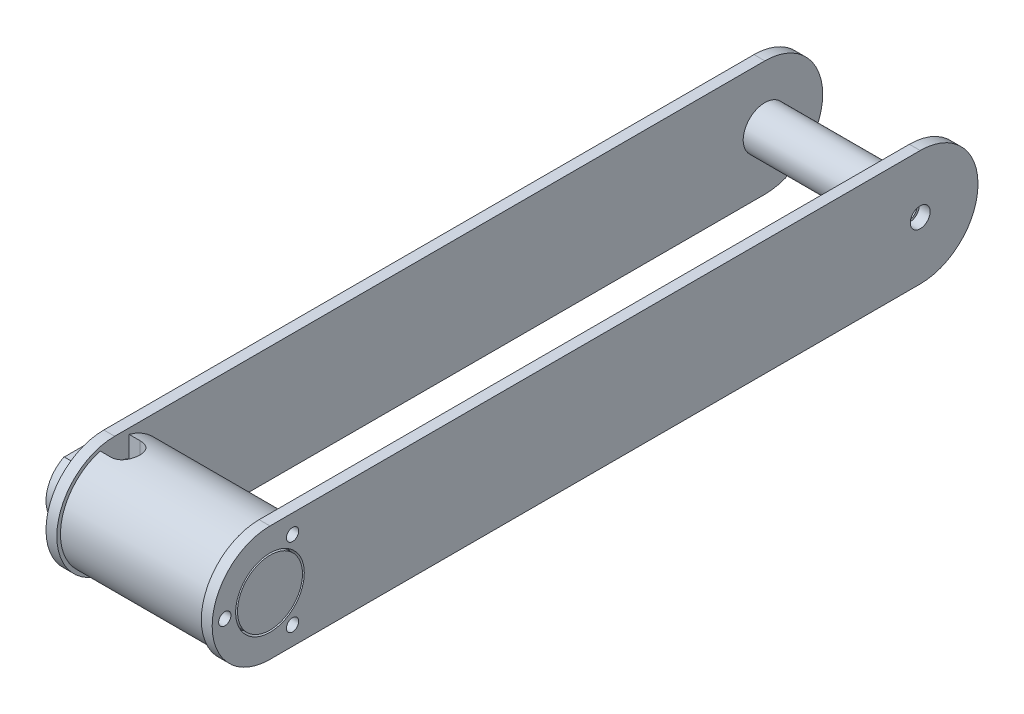
from build123d import *

# Parameters (mm, degrees)
SKETCH1_R                    = 15
BOSS_EXTRUDE1_DEPTH          = 20
SKETCH11_R                   = 9
BOSS_EXTRUDE4_DEPTH          = 10
BOSS_EXTRUDE5_START          = 3
SKETCH12_R                   = 9
BOSS_EXTRUDE5_DEPTH          = 3
SKETCH2_R                    = 2.75
SKETCH2_R_2                  = 9.5
BOSS_EXTRUDE2_DEPTH          = 3
SKETCH13_R                   = 6
BOSS_EXTRUDE6_DEPTH          = 40
M3_START                     = 20
M3_CLEARANCE_HOLE1_OUTLINE_R = 1.7
M3_CLEARANCE_HOLE1_DEPTH     = 3
CUT_EXTRUDE1_DEPTH           = 8
CUT_EXTRUDE3_DEPTH           = 202.298286133
SKETCH16_R                   = 2
CUT_EXTRUDE2_DEPTH           = 30
SKETCH18_W                   = 1.25
SKETCH18_H                   = 8
M3_TAPPED_HOLE2_AT_2_COUNT   = 2
M3_TAPPED_HOLE2_AT_2_PITCH   = 9
M3_TAPPED_HOLE1_AT_2_COUNT   = 2
M3_TAPPED_HOLE1_AT_2_PITCH   = 21.650635095
M3_TAPPED_HOLE1_AT_3_COUNT   = 2
M3_TAPPED_HOLE1_AT_3_PITCH   = 21.650635095


# Read off the part's stored shape, not the designer's step: M3 Clearance Hole1
with BuildPart() as part:
    # Sketch1 → Boss-Extrude1 (new, symmetric)
    with BuildSketch(Plane(origin=(0, 0, 0), x_dir=(0, 0, -1), z_dir=(1, 0, 0))):
        Circle(SKETCH1_R)
    extrude(amount=BOSS_EXTRUDE1_DEPTH, both=True)

    # Sketch11 → Boss-Extrude4 (add)
    with BuildSketch(Plane.ZY.offset(20)):
        Circle(SKETCH11_R)
    extrude(amount=BOSS_EXTRUDE4_DEPTH)

    # Sketch12 → Boss-Extrude5 (add)
    with BuildSketch(Plane(origin=(20, 0, 0), x_dir=(0, 0, -1), z_dir=(1, 0, 0)).offset(BOSS_EXTRUDE5_START)):
        with Locations(Location((0, 0, 0), (0, 0, 180))):
            Circle(SKETCH12_R)
    extrude(amount=-BOSS_EXTRUDE5_DEPTH)

    # Sketch15 → Cut-Extrude1 (cut)
    with BuildSketch(Plane(origin=(0, 16, 0), x_dir=(1, 0, 0), z_dir=(0, 1, 0))):
        with BuildLine():
            Line((-17, -4), (-20, -4))
            Line((-20, -4), (-20, 4))
            Line((-20, 4), (-17, 4))
            ThreePointArc((-17, 4), (-13, 0), (-17, -4))
        make_face()
    extrude(amount=-CUT_EXTRUDE1_DEPTH, mode=Mode.SUBTRACT)

    # Sketch23 → Cut-Extrude3 (cut, through all)
    with BuildSketch(Plane(origin=(-20, 0, 0), x_dir=(0, 0, -1), z_dir=(1, 0, 0))):
        with BuildLine():
            Line((-4, 8), (4, 8))
            Line((4, 8), (4, 8.062257748))
            ThreePointArc((4, 8.062257748), (0, 9), (-4, 8.062257748))
            Line((-4, 8.062257748), (-4, 8))
        make_face()
    extrude(amount=-CUT_EXTRUDE3_DEPTH, mode=Mode.SUBTRACT)

    # Sketch16 → Cut-Extrude2 (cut)
    with BuildSketch(Plane.ZY.offset(30)):
        Circle(SKETCH16_R)
    extrude(amount=-CUT_EXTRUDE2_DEPTH, mode=Mode.SUBTRACT)

    # Sketch18 → M3 Tapped Hole2 (revolve, cut)
    with BuildSketch(Plane(origin=(-17, 8, 0), x_dir=(0, 0, 1), z_dir=(1, 0, 0))):
        with Locations((0.625, 4)):
            Rectangle(SKETCH18_W, SKETCH18_H)
    m3_tapped_hole2 = revolve(axis=Axis((-17, 14.35, 0), (0, -1, 0)), mode=Mode.SUBTRACT)

    # M3 Tapped Hole2 at 2: M3 Tapped Hole2 ×2
    with Locations(*[(-i * M3_TAPPED_HOLE2_AT_2_PITCH, 0, 0) for i in range(1, M3_TAPPED_HOLE2_AT_2_COUNT)]):
        add(m3_tapped_hole2, mode=Mode.SUBTRACT)

    # Sketch21 → M3 Tapped Hole1 (revolve, cut)
    with BuildSketch(Plane(origin=(20, 0, 12.5), x_dir=(0, 0, -1), z_dir=(0, 1, 0))):
        Polygon((0, 0), (0, 12.751075774), (1.25, 12), (1.25, 0), align=None)
    m3_tapped_hole1 = revolve(axis=Axis((26.35, 0, 12.5), (-1, 0, 0)), mode=Mode.SUBTRACT)

    # M3 Tapped Hole1 at 2: M3 Tapped Hole1 ×2
    with Locations(*[Vector(0, 0.5000000000000012, -0.866025403784438) * (i * M3_TAPPED_HOLE1_AT_2_PITCH) for i in range(1, M3_TAPPED_HOLE1_AT_2_COUNT)]):
        add(m3_tapped_hole1, mode=Mode.SUBTRACT)

    # M3 Tapped Hole1 at 3: M3 Tapped Hole1 ×2
    with Locations(*[Vector(0, -0.500000000000001, -0.866025403784438) * (i * M3_TAPPED_HOLE1_AT_3_PITCH) for i in range(1, M3_TAPPED_HOLE1_AT_3_COUNT)]):
        add(m3_tapped_hole1, mode=Mode.SUBTRACT)

    # Mirror6: M3 Tapped Hole1 across plane
    add(m3_tapped_hole1.mirror(Plane(origin=(0, 0, 0), x_dir=(0, 0, 1), z_dir=(1, 0, 0))), mode=Mode.SUBTRACT)

    # Mirror6 copy 1 sketch → Mirror6 copy 1 (revolve, cut)
    with BuildSketch(Plane(origin=(-20, 10.825317547, -6.25), x_dir=(0, 0, -1), z_dir=(0, 1, 0))):
        Polygon((0, 0), (0, -12.751075774), (1.25, -12), (1.25, 0), align=None)
    revolve(axis=Axis((-26.35, 10.825317547, -6.25), (-1, 0, 0)), mode=Mode.SUBTRACT)

    # Mirror6 copy 2 sketch → Mirror6 copy 2 (revolve, cut)
    with BuildSketch(Plane(origin=(-20, -10.825317547, -6.25), x_dir=(0, 0, -1), z_dir=(0, 1, 0))):
        Polygon((0, 0), (0, -12.751075774), (1.25, -12), (1.25, 0), align=None)
    revolve(axis=Axis((-26.35, -10.825317547, -6.25), (-1, 0, 0)), mode=Mode.SUBTRACT)


with BuildPart() as body_2:
    # Sketch2 → Boss-Extrude2 (new body)
    with BuildSketch(Plane(origin=(20, 0, 0), x_dir=(0, 0, -1), z_dir=(1, 0, 0))):
        with BuildLine():
            Line((0, 16), (180, 16))
            ThreePointArc((180, 16), (196, 0), (180, -16))
            Line((180, -16), (0, -16))
            ThreePointArc((0, -16), (-16, 0), (0, 16))
        make_face()
        with Locations((180, 0)):
            Circle(SKETCH2_R, mode=Mode.SUBTRACT)
        Circle(SKETCH2_R_2, mode=Mode.SUBTRACT)
    extrude(amount=BOSS_EXTRUDE2_DEPTH)

    # M3 Clearance Hole1 outline → M3 Clearance Hole1 (cut)
    with BuildSketch(Plane.YZ.offset(M3_START)):
        with Locations((-10.825317547, -6.25)):
            Circle(M3_CLEARANCE_HOLE1_OUTLINE_R)
        with Locations((0, 12.5)):
            Circle(M3_CLEARANCE_HOLE1_OUTLINE_R)
        with Locations((10.825317547, -6.25)):
            Circle(M3_CLEARANCE_HOLE1_OUTLINE_R)
    extrude(amount=M3_CLEARANCE_HOLE1_DEPTH, mode=Mode.SUBTRACT)


with BuildPart() as body_3:
    # Sketch13 → Boss-Extrude6 (new body)
    with BuildSketch(Plane.ZY.offset(-20)):
        with Locations(Location((-180, 0, 0), (0, 0, 180))):
            Circle(SKETCH13_R)
    extrude(amount=BOSS_EXTRUDE6_DEPTH)

    # Sketch27 → M5 Tapped Hole1 (revolve, cut)
    with BuildSketch(Plane(origin=(20, 0, -180), x_dir=(0, 0, -1), z_dir=(0, 1, 0))):
        Polygon((0, 0), (0, 15.6618073), (2.1, 14.4), (2.1, 0), align=None)
    m5_tapped_hole1 = revolve(axis=Axis((26.35, 0, -180), (-1, 0, 0)), mode=Mode.SUBTRACT)

    # Mirror7: M5 Tapped Hole1 across plane
    add(m5_tapped_hole1.mirror(Plane(origin=(0, 0, 0), x_dir=(0, 0, 1), z_dir=(1, 0, 0))), mode=Mode.SUBTRACT)


with BuildPart() as body_4:
    # Mirror2: mirrored copy
    add(body_2.part.mirror(Plane(origin=(0, 0, 0), x_dir=(0, 0, 1), z_dir=(1, 0, 0))))


solid = Compound([part.part, body_2.part, body_3.part, body_4.part])
